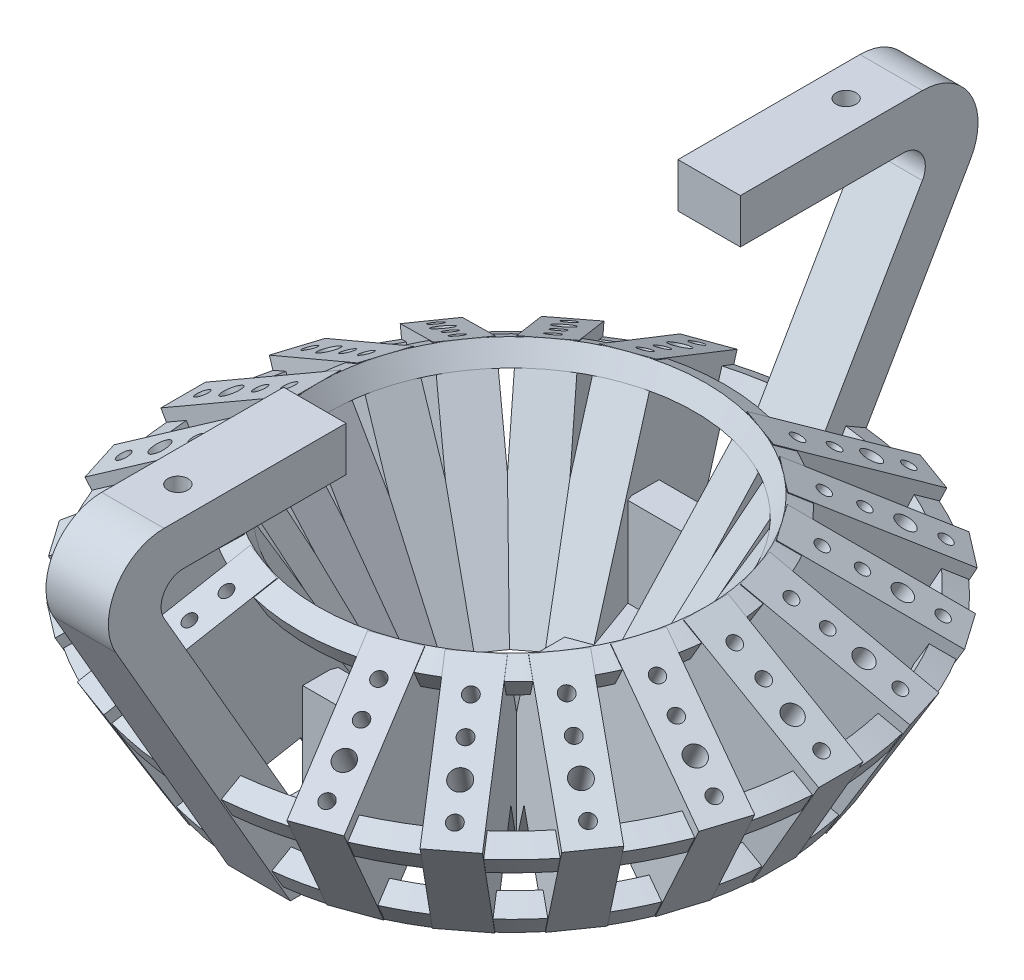
from build123d import *

# Parameters (mm, degrees)
KEYPIECE_DEPTH      = 1
REVOLVE4_ANGLE      = 90
REVOLVE5_ANGLE      = 90
CIRPATTERN12_COUNT  = 5
CIRPATTERN12_ANGLE  = 70
CIRPATTERN14_COUNT  = 5
CIRPATTERN14_ANGLE  = 70
SKKEYPIECEHOLES_R   = 0.3
SKKEYPIECEHOLES_R_2 = 0.43
CUT_EXTRUDE5_DEPTH  = 20.870506705
CIRPATTERN15_COUNT  = 5
CIRPATTERN15_ANGLE  = 70
CIRPATTERN16_COUNT  = 5
CIRPATTERN16_ANGLE  = 70
BOSS_EXTRUDE2_DEPTH = 1.4
SKETCH15_R          = 0.8
CUT_EXTRUDE6_DEPTH  = 10
SKETCH16_W          = 2.8
SKETCH16_H          = 1.5
BOSS_EXTRUDE4_DEPTH = 4
SKETCH17_R          = 0.45
CUT_EXTRUDE7_DEPTH  = 3.5


with BuildPart() as part:
    # skKeyPiece → KeyPiece (new, symmetric)
    with BuildSketch(Plane.XY):
        Polygon((8.700961894, 18.070508076), (14.763139721, 14.570508076), (11.763139721, 9.374355653), (7.866025404, 11.624355653), (5.866025404, 8.160254038), (5, 8.660254038), (3.700961894, 9.410254038), align=None)
    keypiece = extrude(amount=KEYPIECE_DEPTH, both=True)

    # Sketch11 → Revolve4 (revolve)
    with BuildSketch(Plane.XY):
        Polygon((14.523318583, 14.15512568), (13.657293179, 14.65512568), (13.157293179, 13.789100276), (14.023318583, 13.289100276), align=None)
        Polygon((6.366025404, 9.026279442), (5.5, 9.526279442), (5, 8.660254038), (5.866025404, 8.160254038), align=None)
        Polygon((11.763139721, 9.374355653), (12.263139721, 10.240381057), (11.397114317, 10.740381057), (10.897114317, 9.874355653), align=None)
        Polygon((8.700961894, 18.070508076), (8.200961894, 17.204482672), (9.066987298, 16.704482672), (9.566987298, 17.570508076), align=None)
    revolve(axis=Axis((0, 29.225564846, 0), (0, -1, 0)), revolution_arc=REVOLVE4_ANGLE)

    # Sketch11<2> → Revolve5 (revolve)
    with BuildSketch(Plane.XY):
        Polygon((14.523318583, 14.15512568), (13.657293179, 14.65512568), (13.157293179, 13.789100276), (14.023318583, 13.289100276), align=None)
        Polygon((6.366025404, 9.026279442), (5.5, 9.526279442), (5, 8.660254038), (5.866025404, 8.160254038), align=None)
        Polygon((11.763139721, 9.374355653), (12.263139721, 10.240381057), (11.397114317, 10.740381057), (10.897114317, 9.874355653), align=None)
        Polygon((8.700961894, 18.070508076), (8.200961894, 17.204482672), (9.066987298, 16.704482672), (9.566987298, 17.570508076), align=None)
    revolve(axis=Axis((0, 29.225564846, 0), (0, 1, 0)), revolution_arc=REVOLVE5_ANGLE)

    # CirPattern12: KeyPiece ×5 about axis
    cirpattern12_axis = Axis((0, 29.225564846, 0), (0, -1, 0))
    for i in range(1, CIRPATTERN12_COUNT):
        add(keypiece.rotate(cirpattern12_axis, i * CIRPATTERN12_ANGLE / (CIRPATTERN12_COUNT - 1)))

    # CirPattern14: KeyPiece ×5 about axis
    cirpattern14_axis = Axis((0, 29.225564846, 0), (0, 1, 0))
    for i in range(1, CIRPATTERN14_COUNT):
        add(keypiece.rotate(cirpattern14_axis, i * CIRPATTERN14_ANGLE / (CIRPATTERN14_COUNT - 1)))

    # skKeyPieceHoles → Cut-Extrude5 (cut, through all)
    with BuildSketch(Plane(origin=(10, 17.320508076, 0), x_dir=(0.8660254037844385, -0.5000000000000004, 0), z_dir=(0.5000000000000003, 0.8660254037844384, 0))):
        Circle(SKKEYPIECEHOLES_R)
        with Locations((1.5, 0)):
            Circle(SKKEYPIECEHOLES_R)
        with Locations((3, 0)):
            Circle(SKKEYPIECEHOLES_R_2)
        with Locations((4.5, 0)):
            Circle(SKKEYPIECEHOLES_R)
    cut_extrude5 = extrude(amount=-CUT_EXTRUDE5_DEPTH, mode=Mode.SUBTRACT)

    # CirPattern15: Cut-Extrude5 ×5 about axis
    cirpattern15_axis = Axis((0, 29.225564846, 0), (0, -1, 0))
    for i in range(1, CIRPATTERN15_COUNT):
        add(cut_extrude5.rotate(cirpattern15_axis, i * CIRPATTERN15_ANGLE / (CIRPATTERN15_COUNT - 1)), mode=Mode.SUBTRACT)

    # CirPattern16: Cut-Extrude5 ×5 about axis
    cirpattern16_axis = Axis((0, 29.225564846, 0), (0, 1, 0))
    for i in range(1, CIRPATTERN16_COUNT):
        add(cut_extrude5.rotate(cirpattern16_axis, i * CIRPATTERN16_ANGLE / (CIRPATTERN16_COUNT - 1)), mode=Mode.SUBTRACT)

    # Mirror3: part across plane


with BuildPart() as part_1:
    add(part.part)
    add(part.part.mirror(Plane(origin=(0, 0, 0), x_dir=(0, 0, 1), z_dir=(1, 0, 0))))

    # Sketch13 → Boss-Extrude2 (add, symmetric)
    with BuildSketch(Plane(origin=(0, 0, 0), x_dir=(0, 0, -1), z_dir=(1, 0, 0))):
        with BuildLine():
            Line((11.350852961, 8.660254038), (19.185789452, 22.230762114))
            ThreePointArc((19.185789452, 22.230762114), (19.185789452, 24.730762114), (17.020725942, 25.980762114))
            Line((17.020725942, 25.980762114), (8.850852961, 25.980762114))
            Line((8.850852961, 25.980762114), (8.850852961, 23.980762114))
            Line((8.850852961, 23.980762114), (16.154700538, 23.980762114))
            ThreePointArc((16.154700538, 23.980762114), (17.020725942, 23.480762114), (17.020725942, 22.480762114))
            Line((17.020725942, 22.480762114), (9.791451884, 9.959292144))
            Line((9.791451884, 9.959292144), (-0.06009996, 9.959292144))
            Line((-0.06009996, 9.959292144), (-0.81009996, 8.660254038))
            Line((-0.81009996, 8.660254038), (11.350852961, 8.660254038))
        make_face()
    boss_extrude2 = extrude(amount=BOSS_EXTRUDE2_DEPTH, both=True)

    # Mirror4: Boss-Extrude2 across plane
    add(boss_extrude2.mirror(Plane.XY))

    # Sketch15 → Cut-Extrude6 (cut)
    with BuildSketch(Plane(origin=(0, 9.959292144, 0), x_dir=(1, 0, 0), z_dir=(0, 1, 0))):
        Circle(SKETCH15_R)
        with Locations((0, 2.25)):
            Circle(SKETCH15_R)
        with Locations((0, -2.25)):
            Circle(SKETCH15_R)
    extrude(amount=-CUT_EXTRUDE6_DEPTH, mode=Mode.SUBTRACT)

    # Sketch16 → Boss-Extrude4 (add)
    with BuildSketch(Plane(origin=(0, 9.959292144, 0), x_dir=(1, 0, 0), z_dir=(0, 1, 0))):
        with Locations((0, 7.25)):
            Rectangle(SKETCH16_W, SKETCH16_H)
        with Locations((0, -7.25)):
            Rectangle(SKETCH16_W, SKETCH16_H)
    extrude(amount=BOSS_EXTRUDE4_DEPTH)

    # Sketch17 → Cut-Extrude7 (cut)
    with BuildSketch(Plane(origin=(0, 25.980762114, 0), x_dir=(1, 0, 0), z_dir=(0, 1, 0))):
        with Locations((0, -15)):
            Circle(SKETCH17_R)
    cut_extrude7 = extrude(amount=-CUT_EXTRUDE7_DEPTH, mode=Mode.SUBTRACT)

    # Mirror5: Cut-Extrude7 across plane
    add(cut_extrude7.mirror(Plane.XY), mode=Mode.SUBTRACT)


solid = part_1.part
